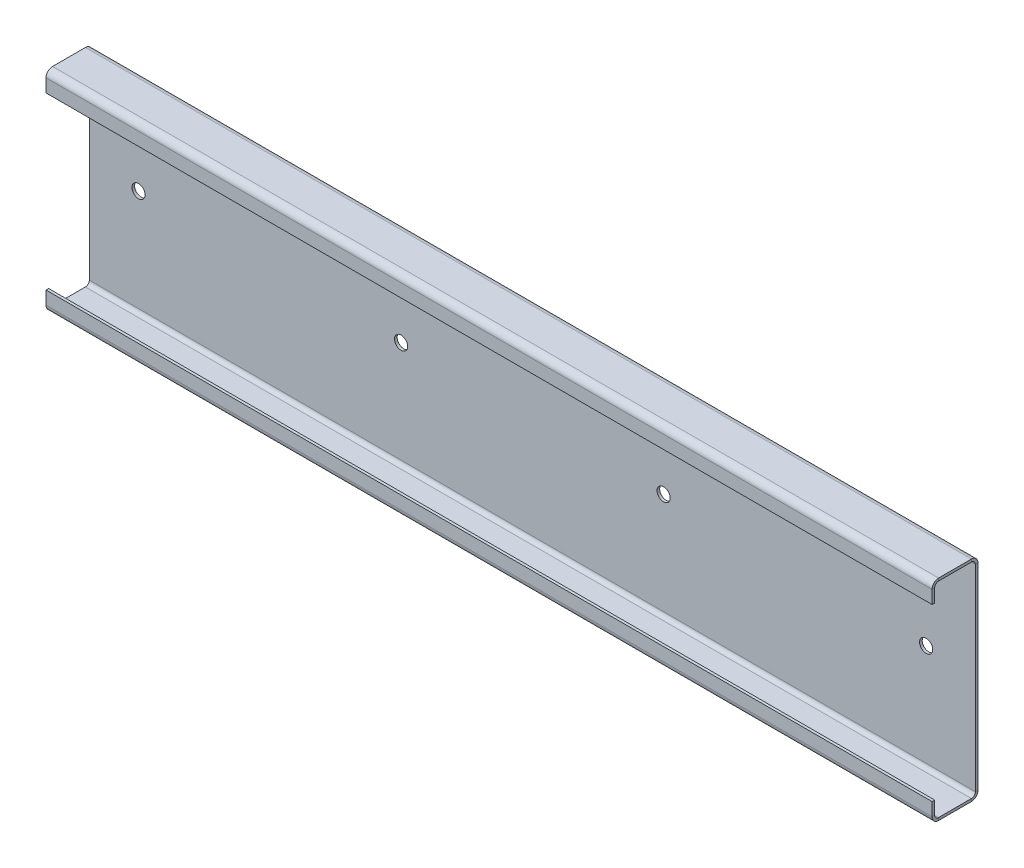
from build123d import *

# Parameters (mm, degrees)
SKETCH1_W                      = 675
SKETCH1_H                      = 160
BASE_FLANGE1_DEPTH             = 2
EDGE_FLANGE1_STRIP_W           = 14
EDGE_FLANGE1_STRIP_H           = 2
EDGE_FLANGE1_STRIP_CUT_DEPTH   = 675
EDGE_FLANGE1_STRIP_2_W         = 14
EDGE_FLANGE1_STRIP_2_H         = 2
EDGE_FLANGE1_STRIP_CUT_2_DEPTH = 675
EDGE_FLANGE1_DEPTH             = 675
EDGE_FLANGE1_BEND_DEPTH        = 675
EDGE_FLANGE2_STRIP_W           = 14
EDGE_FLANGE2_STRIP_H           = 2
EDGE_FLANGE2_STRIP_CUT_DEPTH   = 675
EDGE_FLANGE2_STRIP_2_W         = 14
EDGE_FLANGE2_STRIP_2_H         = 2
EDGE_FLANGE2_STRIP_CUT_2_DEPTH = 675
EDGE_FLANGE2_DEPTH             = 675
EDGE_FLANGE2_BEND_DEPTH        = 675
SKETCH18_R                     = 5
CUT_EXTRUDE1_DEPTH             = 10
LPATTERN1_COUNT                = 4
LPATTERN1_PITCH                = 200


# Sheet-metal steps are written as plain solids
with BuildPart() as part:
    # Sketch1 → Base-Flange1 (new body)
    with BuildSketch(Plane.XY):
        Rectangle(SKETCH1_W, SKETCH1_H)
    extrude(amount=-BASE_FLANGE1_DEPTH)

    # Edge-Flange1 strip (across the edge) → Edge-Flange1 strip cut (cut)
    with BuildSketch(Plane(origin=(337.5, 80, 0), x_dir=(0, -1, 0), z_dir=(-1, 0, 0))):
        with Locations((-2, -1)):
            Rectangle(EDGE_FLANGE1_STRIP_W, EDGE_FLANGE1_STRIP_H)
    extrude(amount=EDGE_FLANGE1_STRIP_CUT_DEPTH, mode=Mode.SUBTRACT)

    # Edge-Flange1 strip 2 (across the edge) → Edge-Flange1 strip cut 2 (cut)
    with BuildSketch(Plane(origin=(-337.5, -80, 0), x_dir=(0, 1, 0), z_dir=(1, 0, 0))):
        with Locations((-2, -1)):
            Rectangle(EDGE_FLANGE1_STRIP_2_W, EDGE_FLANGE1_STRIP_2_H)
    extrude(amount=EDGE_FLANGE1_STRIP_CUT_2_DEPTH, mode=Mode.SUBTRACT)

    # Edge-Flange1 section (across the edge) → Edge-Flange1 (add)
    with BuildSketch(Plane(origin=(337.5, 80, 0), x_dir=(0, -1, 0), z_dir=(-1, 0, 0))):
        with BuildLine():
            Line((0, 3), (0, 33))
            Line((0, 33), (2, 33))
            Line((2, 33), (2, 3))
            ThreePointArc((2, 3), (2.878679656, 0.878679656), (5, 0))
            Line((5, 0), (5, -2))
            ThreePointArc((5, -2), (1.464466094, -0.535533906), (0, 3))
        make_face()
    extrude(amount=EDGE_FLANGE1_DEPTH)

    # Edge-Flange1 section 2 (across the edge) → Edge-Flange1 bend (add)
    with BuildSketch(Plane(origin=(-337.5, -80, 0), x_dir=(0, 1, 0), z_dir=(1, 0, 0))):
        with BuildLine():
            Line((0, 3), (0, 33))
            Line((0, 33), (2, 33))
            Line((2, 33), (2, 3))
            ThreePointArc((2, 3), (2.878679656, 0.878679656), (5, 0))
            Line((5, 0), (5, -2))
            ThreePointArc((5, -2), (1.464466094, -0.535533906), (0, 3))
        make_face()
    extrude(amount=EDGE_FLANGE1_BEND_DEPTH)

    # Edge-Flange2 strip (across the edge) → Edge-Flange2 strip cut (cut)
    with BuildSketch(Plane(origin=(-337.5, -78, 33), x_dir=(0, 0, -1), z_dir=(1, 0, 0))):
        with Locations((-2, -1)):
            Rectangle(EDGE_FLANGE2_STRIP_W, EDGE_FLANGE2_STRIP_H)
    extrude(amount=EDGE_FLANGE2_STRIP_CUT_DEPTH, mode=Mode.SUBTRACT)

    # Edge-Flange2 strip 2 (across the edge) → Edge-Flange2 strip cut 2 (cut)
    with BuildSketch(Plane(origin=(337.5, 78, 33), x_dir=(0, 0, -1), z_dir=(-1, 0, 0))):
        with Locations((-2, -1)):
            Rectangle(EDGE_FLANGE2_STRIP_2_W, EDGE_FLANGE2_STRIP_2_H)
    extrude(amount=EDGE_FLANGE2_STRIP_CUT_2_DEPTH, mode=Mode.SUBTRACT)

    # Edge-Flange2 section (across the edge) → Edge-Flange2 (add)
    with BuildSketch(Plane(origin=(-337.5, -78, 33), x_dir=(0, 0, -1), z_dir=(1, 0, 0))):
        with BuildLine():
            Line((0, 3), (0, 13))
            Line((0, 13), (2, 13))
            Line((2, 13), (2, 3))
            ThreePointArc((2, 3), (2.878679656, 0.878679656), (5, 0))
            Line((5, 0), (5, -2))
            ThreePointArc((5, -2), (1.464466094, -0.535533906), (0, 3))
        make_face()
    extrude(amount=EDGE_FLANGE2_DEPTH)

    # Edge-Flange2 section 2 (across the edge) → Edge-Flange2 bend (add)
    with BuildSketch(Plane(origin=(337.5, 78, 33), x_dir=(0, 0, -1), z_dir=(-1, 0, 0))):
        with BuildLine():
            Line((0, 3), (0, 13))
            Line((0, 13), (2, 13))
            Line((2, 13), (2, 3))
            ThreePointArc((2, 3), (2.878679656, 0.878679656), (5, 0))
            Line((5, 0), (5, -2))
            ThreePointArc((5, -2), (1.464466094, -0.535533906), (0, 3))
        make_face()
    extrude(amount=EDGE_FLANGE2_BEND_DEPTH)

    # Sketch18 → Cut-Extrude1 (cut)
    with BuildSketch(Plane(origin=(0, 0, -2), x_dir=(-1, 0, 0), z_dir=(0, 0, -1))):
        with Locations((-300, 2.49)):
            Circle(SKETCH18_R)
    cut_extrude1 = extrude(amount=-CUT_EXTRUDE1_DEPTH, mode=Mode.SUBTRACT)

    # LPattern1: Cut-Extrude1 ×4
    with Locations(*[(-i * LPATTERN1_PITCH, 0, 0) for i in range(1, LPATTERN1_COUNT)]):
        add(cut_extrude1, mode=Mode.SUBTRACT)


solid = part.part
